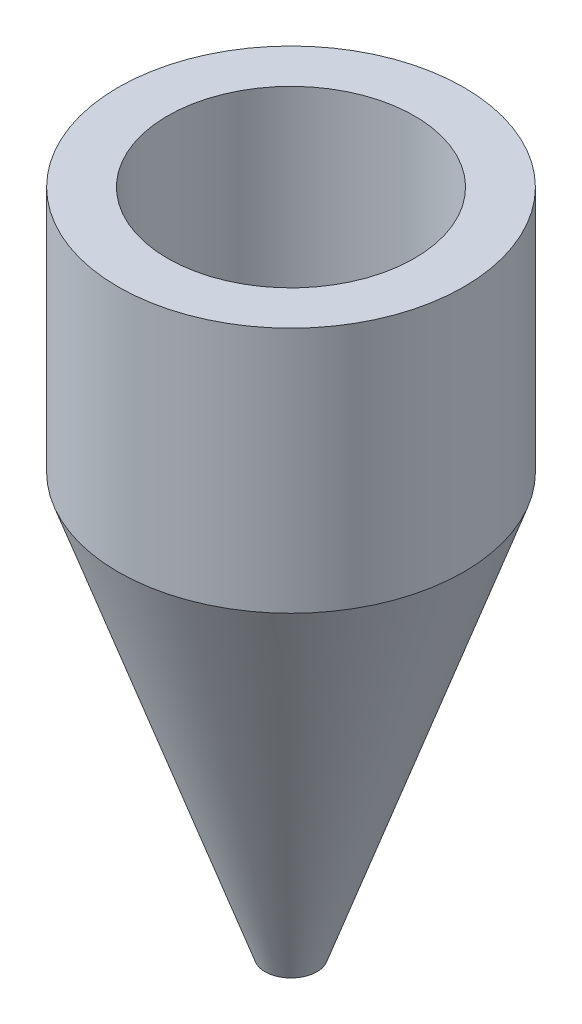
from build123d import *

# Parameters (mm, degrees)
SKETCH1_R               = 8.89
SKETCH1_R_2             = 6.35
BOSS_EXTRUDE1_DEPTH     = 12.7
CUT_EXTRUDE1_DEPTH      = 29.341210278
CUT_EXTRUDE1_DEPTH_BACK = 29.341210278
SKETCH4_W               = 12.7
SKETCH4_H               = 5.08


# Read off the part's stored shape, not the designer's step: Revolve6
with BuildPart() as part:
    # Sketch1 → Boss-Extrude1 (new body)
    with BuildSketch(Plane(origin=(0, 0, 0), x_dir=(1, 0, 0), z_dir=(0, 1, 0))):
        with Locations(Location((0, 0, 0), (0, 0, 270))):
            Circle(SKETCH1_R)
        with Locations(Location((0, 0, 0), (0, 0, 270))):
            Circle(SKETCH1_R_2, mode=Mode.SUBTRACT)
    extrude(amount=BOSS_EXTRUDE1_DEPTH)

    # Revolve6 outline → Revolve6 (revolve)
    with BuildSketch(Plane.XY):
        Polygon((6.35, 0), (5.309918247, -2.54), (0, -17.711194992), (0, -25.4), (8.89, 0), align=None)
    revolve(axis=Axis((0, 0, 0), (0, 1, 0)))

    # Sketch4 → Cut-Extrude1 (cut, two sides: drawn at the far end of the back side and taken through both)
    with BuildSketch(Plane.XY.offset(-CUT_EXTRUDE1_DEPTH_BACK)):
        with Locations((0, -24.13)):
            Rectangle(SKETCH4_W, SKETCH4_H)
    extrude(amount=CUT_EXTRUDE1_DEPTH + CUT_EXTRUDE1_DEPTH_BACK, mode=Mode.SUBTRACT)


solid = part.part
